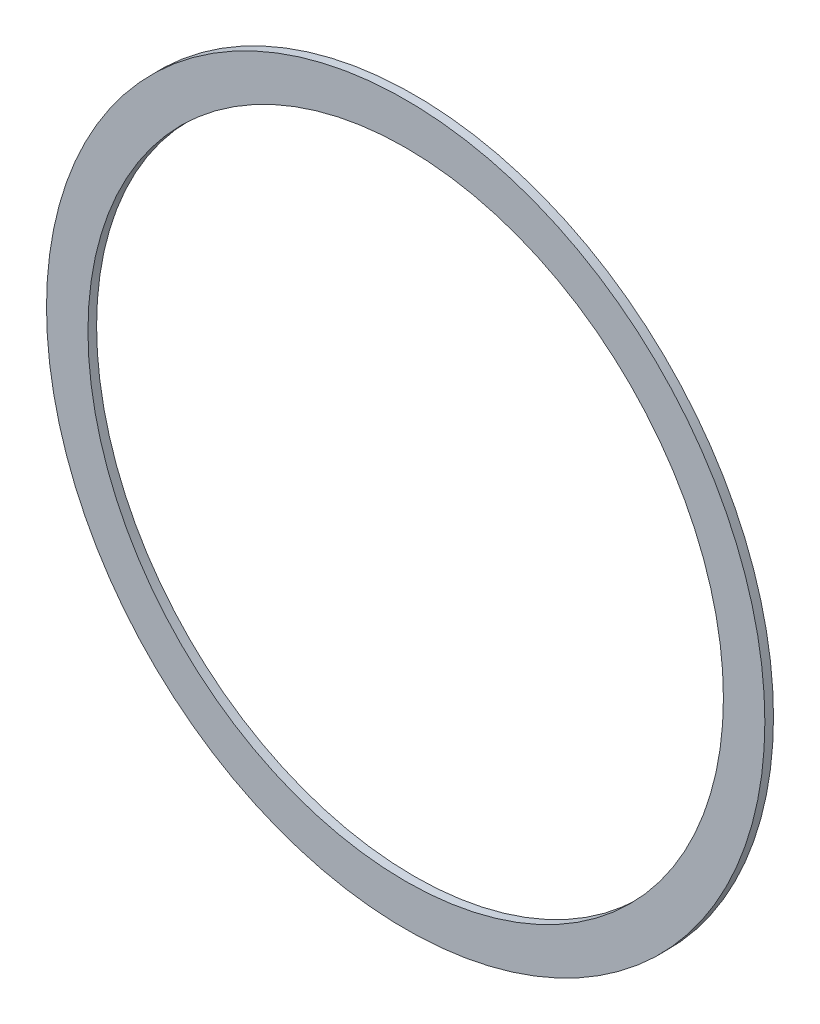
from build123d import *

# Parameters (mm, degrees)
SKETCH2_R           = 116.84
BOSS_EXTRUDE1_DEPTH = 1.5875


with BuildPart() as part:
    # Sketch2 → Boss-Extrude1 (new, symmetric)
    with BuildSketch(Plane.XY):
        with BuildLine():
            ThreePointArc((-1.651, 128.513680847), (-113.442050185, 64.090342472), (-116.977164172, -64.88681984))
            ThreePointArc((-116.977164172, -64.88681984), (-116.591332217, -65.617160575), (-116.200940475, -66.34507415))
            ThreePointArc((-116.200940475, -66.34507415), (-115.806144035, -67.070277165), (-115.406821703, -67.79299794))
            ThreePointArc((-115.406821703, -67.79299794), (0, -135.636), (115.406821703, -67.79299794))
            ThreePointArc((115.406821703, -67.79299794), (115.8045128, -67.073251319), (116.19771518, -66.351042694))
            ThreePointArc((116.19771518, -66.351042694), (116.589738302, -65.620154894), (116.977164172, -64.88681984))
            ThreePointArc((116.977164172, -64.88681984), (113.442050185, 64.090342472), (1.651, 128.513680847))
            ThreePointArc((1.651, 128.513680847), (0.825516124, 128.521420187), (0, 128.524))
            ThreePointArc((0, 128.524), (-0.825516124, 128.521420187), (-1.651, 128.513680847))
        make_face()
        with Locations((0, -3.556)):
            Circle(SKETCH2_R, mode=Mode.SUBTRACT)
    extrude(amount=BOSS_EXTRUDE1_DEPTH, both=True)


solid = part.part
